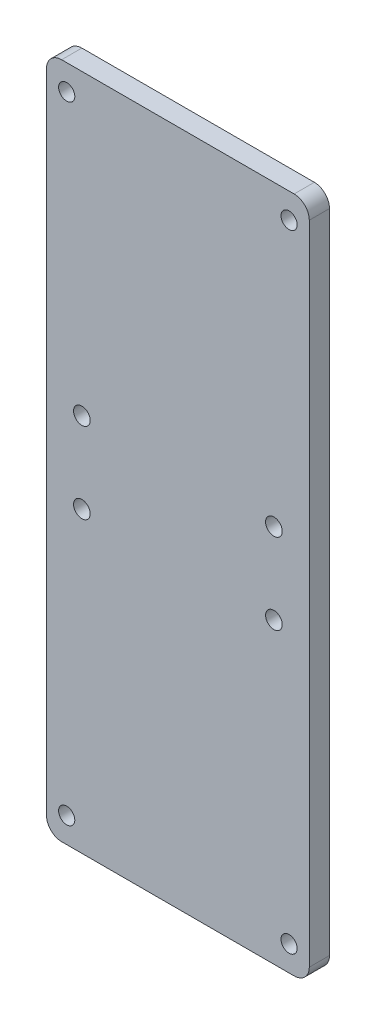
from build123d import *

# Parameters (mm, degrees)
SKETCH1_R           = 1.65
SKETCH1_R_2         = 1.6
BOSS_EXTRUDE1_DEPTH = 4


with BuildPart() as part:
    # Sketch1 → Boss-Extrude1 (new body)
    with BuildSketch(Plane.XY):
        with BuildLine():
            Line((23.206941284, 126.936391703), (23.206941284, -1.063608297))
            ThreePointArc((23.206941284, -1.063608297), (24.085620941, -3.184928641), (26.206941284, -4.063608297))
            Line((26.206941284, -4.063608297), (72.208519176, -4.063608297))
            ThreePointArc((72.208519176, -4.063608297), (74.32983952, -3.184928641), (75.208519176, -1.063608297))
            Line((75.208519176, -1.063608297), (75.208519176, 126.936391703))
            ThreePointArc((75.208519176, 126.936391703), (74.32983952, 129.057712046), (72.208519176, 129.936391703))
            Line((72.208519176, 129.936391703), (26.206941284, 129.936391703))
            ThreePointArc((26.206941284, 129.936391703), (24.085620941, 129.057712046), (23.206941284, 126.936391703))
        make_face()
        with Locations((30.20773023, 54.936391703)):
            Circle(SKETCH1_R, mode=Mode.SUBTRACT)
        with Locations((27.206941284, 0.936391703)):
            Circle(SKETCH1_R_2, mode=Mode.SUBTRACT)
        with Locations((68.20773023, 70.936391703)):
            Circle(SKETCH1_R, mode=Mode.SUBTRACT)
        with Locations((71.208519176, 124.936391703)):
            Circle(SKETCH1_R_2, mode=Mode.SUBTRACT)
        with Locations((71.208519176, 0.936391703)):
            Circle(SKETCH1_R_2, mode=Mode.SUBTRACT)
        with Locations((68.20773023, 54.936391703)):
            Circle(SKETCH1_R, mode=Mode.SUBTRACT)
        with Locations((27.206941284, 124.936391703)):
            Circle(SKETCH1_R_2, mode=Mode.SUBTRACT)
        with Locations((30.20773023, 70.936391703)):
            Circle(SKETCH1_R, mode=Mode.SUBTRACT)
    extrude(amount=BOSS_EXTRUDE1_DEPTH)


solid = part.part
